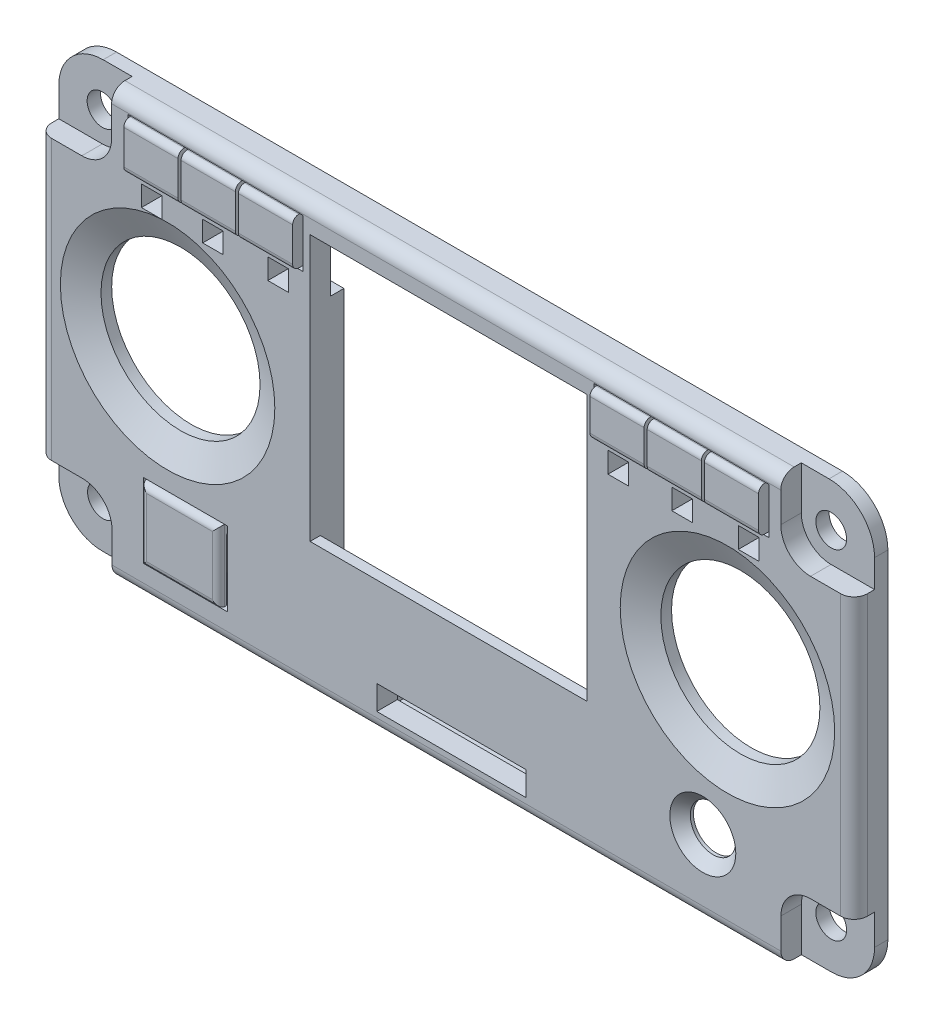
from build123d import *

# Parameters (mm, degrees)
SKETCH_2_R          = 1.5
SKETCH_2_R_2        = 7.75
SKETCH_2_W          = 15.234792178
SKETCH_2_H          = 3.697307595
SKETCH_2_W_2        = 8.2
SKETCH_2_H_2        = 7.25
EXTRUDE_1_DEPTH     = 1.3
SKETCH_3_R          = 2.215559352
SKETCH_3_R_2        = 7.75
SKETCH_3_W          = 17.056855075
SKETCH_3_H          = 4.735306071
SKETCH_3_W_2        = 17.030095755
SKETCH_3_H_2        = 4.492913246
SKETCH_3_W_3        = 26.977227456
SKETCH_3_H_3        = 30.396541946
SKETCH_3_W_4        = 14.554708766
SKETCH_3_H_4        = 2.363471056
EXTRUDE_2_DEPTH     = 2
CHAMFER_1_SIZE      = 2.7
CHAMFER_1_SIZE2     = 1.259030677
CHAMFER_2_SIZE      = 1
FILLET_1_R          = 1.3
CUT_EXTRUDE_1_REACH = 89.69
SKETCH_4_W          = 2.0000254
SKETCH_4_H          = 2.024130048
SKETCH_4_W_2        = 2
SKETCH_4_H_2        = 2
SKETCH_5_W          = 5.285618358
SKETCH_5_H          = 4.535306071
SKETCH_5_W_2        = 5.285618359
SKETCH_5_W_3        = 5.276698585
SKETCH_5_H_2        = 4.292913246
EXTRUDE_3_DEPTH     = 0.3
SKETCH_6_R          = 1.4999492
SKETCH_6_R_2        = 1.511556883
EXTRUDE_4_DEPTH     = 0.4
SKETCH_7_W          = 5.285618358
SKETCH_7_H          = 4.535306071
SKETCH_7_W_2        = 5.285618359
SKETCH_7_W_3        = 5.276698585
SKETCH_7_H_2        = 4.292913246
EXTRUDE_5_DEPTH     = 0.7
FILLET_2_R          = 0.6
SKETCH_8_W          = 8.2
SKETCH_8_H          = 7.25
CUT_EXTRUDE_2_DEPTH = 2
SKETCH_9_W          = 7.6
SKETCH_9_H          = 6.95
EXTRUDE_6_DEPTH     = 0.2
SKETCH_11_W         = 7.6
SKETCH_11_H         = 6.95
EXTRUDE_8_DEPTH     = 0.6
FILLET_3_R          = 0.6
CHAMFER_3_SIZE      = 0.6
CUT_EXTRUDE_3_DEPTH = 0.7
CHAMFER_4_SIZE      = 1
CHAMFER_4_SIZE2     = 0.839099631
SKETCH_13_W         = 19.399998684
SKETCH_13_H         = 18.450001368
SKETCH_13_W_2       = 19.40000088
SKETCH_13_H_2       = 18.449999086
CUT_EXTRUDE_4_DEPTH = 1
SKETCH_14_W         = 26.977227456
SKETCH_14_H         = 4.5
EXTRUDE_9_DEPTH     = 1
SKETCH_15_R         = 1.5
EXTRUDE_10_DEPTH    = 1.3
CUT_EXTRUDE_START   = -0.8
SKETCH_16_R         = 1.5
CUT_EXTRUDE_5_DEPTH = 0.8


with BuildPart() as part:
    # 草图2 → 凸台-拉伸1 (new body)
    with BuildSketch(Plane.XY):
        with BuildLine():
            Line((2.794005588, 39.995377191), (73.533147066, 39.995377191))
            ThreePointArc((73.533147066, 39.995377191), (76.669382065, 38.696306119), (77.968453137, 35.56007112))
            Line((77.968453137, 35.56007112), (77.968453137, 2.667005334))
            ThreePointArc((77.968453137, 2.667005334), (76.743777092, -0.289624184), (73.787147574, -1.514300229))
            Line((73.787147574, -1.514300229), (2.71495809, -1.514300229))
            ThreePointArc((2.71495809, -1.514300229), (-0.286572798, -0.271025427), (-1.5298476, 2.730505461))
            Line((-1.5298476, 2.730505461), (-1.5298476, 35.671524003))
            ThreePointArc((-1.5298476, 35.671524003), (-0.263420322, 38.728949913), (2.794005588, 39.995377191))
        make_face()
        with Locations((2.775412751, 2.75501651)):
            Circle(SKETCH_2_R, mode=Mode.SUBTRACT)
        with Locations((73.74478029, 2.75501651)):
            Circle(SKETCH_2_R, mode=Mode.SUBTRACT)
        with Locations((73.74478029, 35.767081534)):
            Circle(SKETCH_2_R, mode=Mode.SUBTRACT)
        with Locations((2.730505461, 35.750571501)):
            Circle(SKETCH_2_R, mode=Mode.SUBTRACT)
        with Locations((65.634110245, 20.953056437)):
            Circle(SKETCH_2_R_2, mode=Mode.SUBTRACT)
        with Locations((11.074044034, 20.953028228)):
            Circle(SKETCH_2_R_2, mode=Mode.SUBTRACT)
        Polygon((6.201811974, 38.595377191), (24.958294363, 38.595377191), (52.374104648, 38.595377191), (70.550517102, 38.595377191), (70.550517102, 31.041943621), (52.374104648, 31.041943621), (52.374104648, 5.083009906), (24.958294363, 5.083009906), (24.958294363, 31.128701581), (6.201811974, 31.128701581), align=None, mode=Mode.SUBTRACT)
        with Locations((38.860535707, 1.734353569)):
            Rectangle(SKETCH_2_W, SKETCH_2_H, mode=Mode.SUBTRACT)
        with Locations((12.827025654, 5.08001016)):
            Rectangle(SKETCH_2_W_2, SKETCH_2_H_2, mode=Mode.SUBTRACT)
        Polygon((68.759477841, 7.753281517), (68.759477841, 3.930741851), (65.235334923, 0.406598933), (61.256918061, 0.406598933), (57.732775144, 3.930741851), (57.732775144, 7.470438806), (61.61769937, 11.355363032), (65.157396326, 11.355363032), align=None, mode=Mode.SUBTRACT)
    extrude(amount=EXTRUDE_1_DEPTH)

    # 草图3 → 凸台-拉伸2 (add)
    with BuildSketch(Plane.XY.offset(1.3)):
        with BuildLine():
            Line((5.61495809, 35.750571501), (5.61495809, 39.995377191))
            Line((5.61495809, 39.995377191), (70.829232918, 39.995377191))
            Line((70.829232918, 39.995377191), (70.829232918, 35.767081534))
            ThreePointArc((70.829232918, 35.767081534), (71.678623253, 33.716471869), (73.729232918, 32.867081534))
            Line((73.729232918, 32.867081534), (77.968453137, 32.867081534))
            Line((77.968453137, 32.867081534), (77.968453137, 5.648853773))
            Line((77.968453137, 5.648853773), (73.74478029, 5.65501651))
            ThreePointArc((73.74478029, 5.65501651), (71.69293091, 4.80686589), (70.84478029, 2.75501651))
            Line((70.84478029, 2.75501651), (70.84478029, -1.514300229))
            Line((70.84478029, -1.514300229), (5.65986538, -1.514300229))
            Line((5.65986538, -1.514300229), (5.65986538, 2.75501651))
            ThreePointArc((5.65986538, 2.75501651), (4.810475045, 4.805626175), (2.75986538, 5.65501651))
            Line((2.75986538, 5.65501651), (-1.5298476, 5.65501651))
            Line((-1.5298476, 5.65501651), (-1.5298476, 32.850571501))
            Line((-1.5298476, 32.850571501), (2.71495809, 32.850571501))
            ThreePointArc((2.71495809, 32.850571501), (4.765567755, 33.699961836), (5.61495809, 35.750571501))
        make_face()
        with Locations((63.232323007, 5.83560042)):
            Circle(SKETCH_3_R, mode=Mode.SUBTRACT)
        with Locations((65.634110245, 20.953056437)):
            Circle(SKETCH_3_R_2, mode=Mode.SUBTRACT)
        with Locations((11.074044034, 20.953028228)):
            Circle(SKETCH_3_R_2, mode=Mode.SUBTRACT)
        with Locations((15.729866826, 36.227724155)):
            Rectangle(SKETCH_3_W, SKETCH_3_H, mode=Mode.SUBTRACT)
        with Locations((61.150569697, 36.348920568)):
            Rectangle(SKETCH_3_W_2, SKETCH_3_H_2, mode=Mode.SUBTRACT)
        with Locations((38.446908091, 22.120792121)):
            Rectangle(SKETCH_3_W_3, SKETCH_3_H_3, mode=Mode.SUBTRACT)
        with Locations((38.740250728, 1.507634921)):
            Rectangle(SKETCH_3_W_4, SKETCH_3_H_4, mode=Mode.SUBTRACT)
    extrude(amount=EXTRUDE_2_DEPTH)

    # 倒角1
    chamfer_1_edges = [part.edges().sort_by_distance(p)[0] for p in [
        (57.884110245, 20.953056437, 3.3),
        (3.324044034, 20.953028228, 3.3),
    ]]
    chamfer_1_side = [part.faces().sort_by_distance(p)[0] for p in [
        (71.058776625, 5.441020175, 3.3),
    ]]
    chamfer(chamfer_1_edges, length=CHAMFER_1_SIZE, length2=CHAMFER_1_SIZE2, reference=chamfer_1_side[0])

    # 倒角2
    chamfer_2_edges = [part.edges().sort_by_distance(p)[0] for p in [
        (61.016763655, 5.83560042, 3.3),
    ]]
    chamfer(chamfer_2_edges, length=CHAMFER_2_SIZE)

    # 圆角1
    fillet_1_edges = [part.edges().sort_by_distance(p)[0] for p in [
        (-1.5298476, 19.252794006, 3.3),
        (38.252322835, -1.514300229, 3.3),
        (77.968453137, 19.257967653, 3.3),
        (38.222095504, 39.995377191, 3.3),
    ]]
    fillet(fillet_1_edges, radius=FILLET_1_R)

    # 切除-拉伸1: up to this face of the body (flat: up to its plane)
    cut_extrude_1_end = Plane(part.part.faces().sort_by_distance((69.982961767, 1.270358141, 3.3))[0])
    # 草图4 → 切除-拉伸1 (cut, up to the picked face)
    with BuildSketch(Plane(origin=(0, 0, 0), x_dir=(-1, 0, 0), z_dir=(0, 0, -1)), mode=Mode.PRIVATE) as cut_extrude_1_sk1:
        with Locations((-67.691148082, 32.627127254)):
            Rectangle(SKETCH_4_W, SKETCH_4_H)
    cut_extrude_1_tool1 = split(extrude(cut_extrude_1_sk1.sketch, amount=-CUT_EXTRUDE_1_REACH, mode=Mode.PRIVATE), bisect_by=cut_extrude_1_end, keep=Keep.BOTH, mode=Mode.PRIVATE)
    # 草图4 → 切除-拉伸1 (cut, up to the picked face)
    with BuildSketch(Plane(origin=(0, 0, 0), x_dir=(-1, 0, 0), z_dir=(0, 0, -1)), mode=Mode.PRIVATE) as cut_extrude_1_sk2:
        with Locations((-61.214147828, 32.639192278)):
            Rectangle(SKETCH_4_W_2, SKETCH_4_H_2)
    cut_extrude_1_tool2 = split(extrude(cut_extrude_1_sk2.sketch, amount=-CUT_EXTRUDE_1_REACH, mode=Mode.PRIVATE), bisect_by=cut_extrude_1_end, keep=Keep.BOTH, mode=Mode.PRIVATE)
    # 草图4 → 切除-拉伸1 (cut, up to the picked face)
    with BuildSketch(Plane(origin=(0, 0, 0), x_dir=(-1, 0, 0), z_dir=(0, 0, -1)), mode=Mode.PRIVATE) as cut_extrude_1_sk3:
        with Locations((-54.991122682, 32.627127254)):
            Rectangle(SKETCH_4_W, SKETCH_4_H)
    cut_extrude_1_tool3 = split(extrude(cut_extrude_1_sk3.sketch, amount=-CUT_EXTRUDE_1_REACH, mode=Mode.PRIVATE), bisect_by=cut_extrude_1_end, keep=Keep.BOTH, mode=Mode.PRIVATE)
    # 草图4 → 切除-拉伸1 (cut, up to the picked face)
    with BuildSketch(Plane(origin=(0, 0, 0), x_dir=(-1, 0, 0), z_dir=(0, 0, -1)), mode=Mode.PRIVATE) as cut_extrude_1_sk4:
        with Locations((-21.844069088, 32.38519177)):
            Rectangle(SKETCH_4_W_2, SKETCH_4_H_2)
    cut_extrude_1_tool4 = split(extrude(cut_extrude_1_sk4.sketch, amount=-CUT_EXTRUDE_1_REACH, mode=Mode.PRIVATE), bisect_by=cut_extrude_1_end, keep=Keep.BOTH, mode=Mode.PRIVATE)
    # 草图4 → 切除-拉伸1 (cut, up to the picked face)
    with BuildSketch(Plane(origin=(0, 0, 0), x_dir=(-1, 0, 0), z_dir=(0, 0, -1)), mode=Mode.PRIVATE) as cut_extrude_1_sk5:
        with Locations((-15.494056388, 32.38519177)):
            Rectangle(SKETCH_4_W_2, SKETCH_4_H_2)
    cut_extrude_1_tool5 = split(extrude(cut_extrude_1_sk5.sketch, amount=-CUT_EXTRUDE_1_REACH, mode=Mode.PRIVATE), bisect_by=cut_extrude_1_end, keep=Keep.BOTH, mode=Mode.PRIVATE)
    # 草图4 → 切除-拉伸1 (cut, up to the picked face)
    with BuildSketch(Plane(origin=(0, 0, 0), x_dir=(-1, 0, 0), z_dir=(0, 0, -1)), mode=Mode.PRIVATE) as cut_extrude_1_sk6:
        with Locations((-9.52504445, 32.38519177)):
            Rectangle(SKETCH_4_W_2, SKETCH_4_H_2)
    cut_extrude_1_tool6 = split(extrude(cut_extrude_1_sk6.sketch, amount=-CUT_EXTRUDE_1_REACH, mode=Mode.PRIVATE), bisect_by=cut_extrude_1_end, keep=Keep.BOTH, mode=Mode.PRIVATE)
    add(cut_extrude_1_tool1.solids().sort_by(Axis((67.691148, 32.627127, 0), (0, 0, 1)))[0], mode=Mode.SUBTRACT)
    add(cut_extrude_1_tool2.solids().sort_by(Axis((61.214148, 32.639192, 0), (0, 0, 1)))[0], mode=Mode.SUBTRACT)
    add(cut_extrude_1_tool3.solids().sort_by(Axis((54.991123, 32.627127, 0), (0, 0, 1)))[0], mode=Mode.SUBTRACT)
    add(cut_extrude_1_tool4.solids().sort_by(Axis((21.844069, 32.385192, 0), (0, 0, 1)))[0], mode=Mode.SUBTRACT)
    add(cut_extrude_1_tool5.solids().sort_by(Axis((15.494056, 32.385192, 0), (0, 0, 1)))[0], mode=Mode.SUBTRACT)
    add(cut_extrude_1_tool6.solids().sort_by(Axis((9.525044, 32.385192, 0), (0, 0, 1)))[0], mode=Mode.SUBTRACT)

    # 草图5 → 凸台-拉伸3 (add)
    with BuildSketch(Plane.XY.offset(3.3)):
        with Locations((10.144248467, 36.327724156)):
            Rectangle(SKETCH_5_W, SKETCH_5_H)
        with Locations((15.729866825, 36.327724156)):
            Rectangle(SKETCH_5_W, SKETCH_5_H)
        with Locations((21.315485184, 36.327724156)):
            Rectangle(SKETCH_5_W_2, SKETCH_5_H)
        with Locations((55.573871112, 36.448920568)):
            Rectangle(SKETCH_5_W_3, SKETCH_5_H_2)
        with Locations((61.150569696, 36.448920568)):
            Rectangle(SKETCH_5_W_3, SKETCH_5_H_2)
        with Locations((66.727268282, 36.448920568)):
            Rectangle(SKETCH_5_W_3, SKETCH_5_H_2)
    extrude(amount=-EXTRUDE_3_DEPTH)

    # 草图6 → 凸台-拉伸4 (add)
    with BuildSketch(Plane(origin=(0, 0, 3), x_dir=(-1, 0, 0), z_dir=(0, 0, -1))):
        with Locations(Location((-9.396113792, 35.56002032, 0), (0, 0, 270))):
            Circle(SKETCH_6_R)
        with Locations(Location((-15.696088392, 35.56002032, 0), (0, 0, 270))):
            Circle(SKETCH_6_R)
        with Locations(Location((-21.996062992, 35.56002032, 0), (0, 0, 270))):
            Circle(SKETCH_6_R)
        with Locations(Location((-54.839090678, 35.814020828, 0), (0, 0, 270))):
            Circle(SKETCH_6_R_2)
        with Locations(Location((-61.139065278, 35.814020828, 0), (0, 0, 270))):
            Circle(SKETCH_6_R_2)
        with Locations(Location((-67.439039878, 35.814020828, 0), (0, 0, 270))):
            Circle(SKETCH_6_R_2)
    extrude(amount=EXTRUDE_4_DEPTH)

    # 草图7 → 凸台-拉伸5 (add)
    with BuildSketch(Plane.XY.offset(3.3)):
        with Locations((10.144248467, 36.327724156)):
            Rectangle(SKETCH_7_W, SKETCH_7_H)
        with Locations((15.729866825, 36.327724156)):
            Rectangle(SKETCH_7_W, SKETCH_7_H)
        with Locations((21.315485184, 36.327724156)):
            Rectangle(SKETCH_7_W_2, SKETCH_7_H)
        with Locations((55.573871112, 36.448920568)):
            Rectangle(SKETCH_7_W_3, SKETCH_7_H_2)
        with Locations((61.150569696, 36.448920568)):
            Rectangle(SKETCH_7_W_3, SKETCH_7_H_2)
        with Locations((66.727268282, 36.448920568)):
            Rectangle(SKETCH_7_W_3, SKETCH_7_H_2)
    extrude(amount=EXTRUDE_5_DEPTH)

    # 圆角2
    fillet_2_edges = [part.edges().sort_by_distance(p)[0] for p in [
        (10.144248467, 38.595377191, 4),
        (10.144248467, 34.06007112, 4),
        (15.729866825, 34.06007112, 4),
        (15.729866825, 38.595377191, 4),
        (21.315485184, 34.06007112, 4),
        (21.315485184, 38.595377191, 4),
        (55.573871112, 34.302463945, 4),
        (55.573871112, 38.595377191, 4),
        (61.150569697, 34.302463945, 4),
        (61.150569697, 38.595377191, 4),
        (66.727268281, 34.302463945, 4),
        (66.727268281, 38.595377191, 4),
    ]]
    fillet(fillet_2_edges, radius=FILLET_2_R)

    # 草图8 → 切除-拉伸2 (cut)
    with BuildSketch(Plane(origin=(0, 0, 1.3), x_dir=(-1, 0, 0), z_dir=(0, 0, -1))):
        with Locations((-12.827025654, 5.08001016)):
            Rectangle(SKETCH_8_W, SKETCH_8_H)
    extrude(amount=-CUT_EXTRUDE_2_DEPTH, mode=Mode.SUBTRACT)

    # 草图9 → 凸台-拉伸6 (add)
    with BuildSketch(Plane.XY.offset(3.3)):
        with Locations((12.827025654, 5.23001016)):
            Rectangle(SKETCH_9_W, SKETCH_9_H)
    extrude(amount=-EXTRUDE_6_DEPTH)

    # 草图11 → 凸台-拉伸8 (add)
    with BuildSketch(Plane.XY.offset(3.3)):
        with Locations((12.827025654, 5.23001016)):
            Rectangle(SKETCH_11_W, SKETCH_11_H)
    extrude(amount=EXTRUDE_8_DEPTH)

    # 圆角3
    fillet_3_edges = [part.edges().sort_by_distance(p)[0] for p in [
        (16.627025654, 5.23001016, 3.9),
        (12.827025654, 1.75501016, 3.9),
        (9.027025654, 5.23001016, 3.9),
        (12.827025654, 8.70501016, 3.9),
    ]]
    fillet(fillet_3_edges, radius=FILLET_3_R - 0.0001)  # a hair under: the kernel refuses the full size

    # 倒角3
    chamfer_3_edges = [part.edges().sort_by_distance(p)[0] for p in [
        (10.144248467, 38.595377191, 3),
        (15.729866825, 38.595377191, 3),
        (21.315485184, 38.595377191, 3),
        (55.573871112, 38.595377191, 3),
        (61.150569697, 38.595377191, 3),
        (66.727268281, 38.595377191, 3),
    ]]
    chamfer(chamfer_3_edges, length=CHAMFER_3_SIZE)

    # 草图12 → 切除-拉伸3 (cut)
    with BuildSketch(Plane(origin=(0, 0, 1.3), x_dir=(-1, 0, 0), z_dir=(0, 0, -1))):
        Polygon((-68.759477841, 7.753281517), (-65.157396326, 11.355363032), (-61.61769937, 11.355363032), (-57.732775144, 7.470438806), (-57.732775144, 3.930741851), (-61.256918061, 0.406598933), (-65.235334923, 0.406598933), (-68.759477841, 3.930741851), align=None)
    extrude(amount=-CUT_EXTRUDE_3_DEPTH, mode=Mode.SUBTRACT)

    # 倒角4
    chamfer_4_edges = [part.edges().sort_by_distance(p)[0] for p in [
        (12.827025654, 8.70501016, 3.1),
    ]]
    chamfer_4_side = [part.faces().sort_by_distance(p)[0] for p in [
        (12.827025654, 5.23001016, 3.1),
    ]]
    chamfer(chamfer_4_edges, length=CHAMFER_4_SIZE, length2=CHAMFER_4_SIZE2, reference=chamfer_4_side[0])

    # 草图13 → 切除-拉伸4 (cut)
    with BuildSketch(Plane(origin=(0, 0, 0), x_dir=(-1, 0, 0), z_dir=(0, 0, -1))):
        with Locations((-65.634110245, 20.828056437)):
            Rectangle(SKETCH_13_W, SKETCH_13_H)
        with Locations((-11.074044034, 20.828028228)):
            Rectangle(SKETCH_13_W_2, SKETCH_13_H_2)
    extrude(amount=-CUT_EXTRUDE_4_DEPTH, mode=Mode.SUBTRACT)

    # 草图14 → 凸台-拉伸9 (add)
    with BuildSketch(Plane.XY.offset(3.3)):
        with Locations((38.446908091, 9.172521148)):
            Rectangle(SKETCH_14_W, SKETCH_14_H)
    extrude(amount=-EXTRUDE_9_DEPTH)

    # 草图15 → 凸台-拉伸10 (add)
    with BuildSketch(Plane(origin=(0, 0, 3.1), x_dir=(-1, 0, 0), z_dir=(0, 0, -1))):
        with Locations(Location((-12.978246062, 4.694315622, 0), (0, 0, 180))):
            Circle(SKETCH_15_R)
    extrude(amount=EXTRUDE_10_DEPTH)

    # 草图16 → 切除-拉伸5 (cut)
    with BuildSketch(Plane(origin=(0, 0, 1.8), x_dir=(-1, 0, 0), z_dir=(0, 0, -1)).offset(CUT_EXTRUDE_START)):
        with Locations(Location((-12.978246062, 4.694315622, 0), (0, 0, 180))):
            Circle(SKETCH_16_R)
    extrude(amount=CUT_EXTRUDE_5_DEPTH, mode=Mode.SUBTRACT)


solid = part.part
